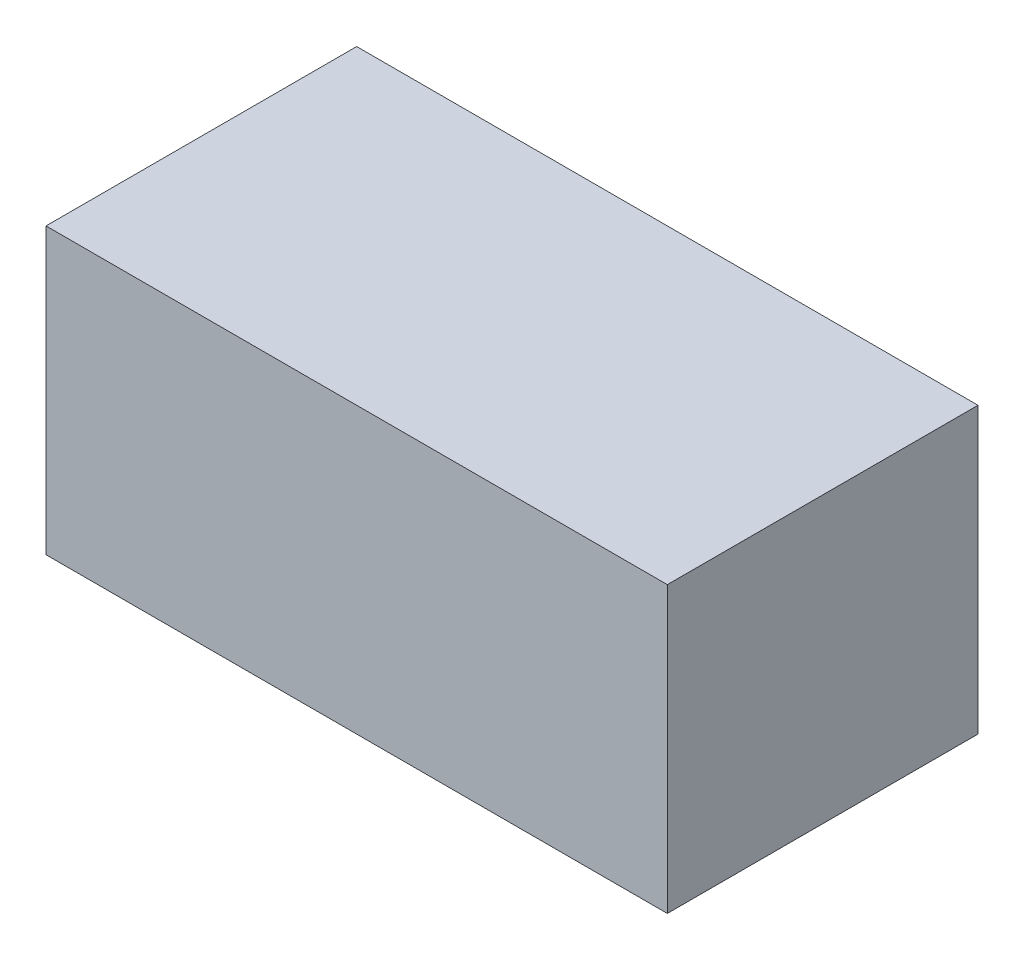
from build123d import *

# Parameters (mm, degrees)
SKETCH_1_W      = 120
SKETCH_1_H      = 55
EXTRUDE_1_DEPTH = 60


with BuildPart() as part:
    # 草圖1 → 填料-伸長1 (new body)
    with BuildSketch(Plane.XY):
        Rectangle(SKETCH_1_W, SKETCH_1_H)
    extrude(amount=EXTRUDE_1_DEPTH)


solid = part.part
